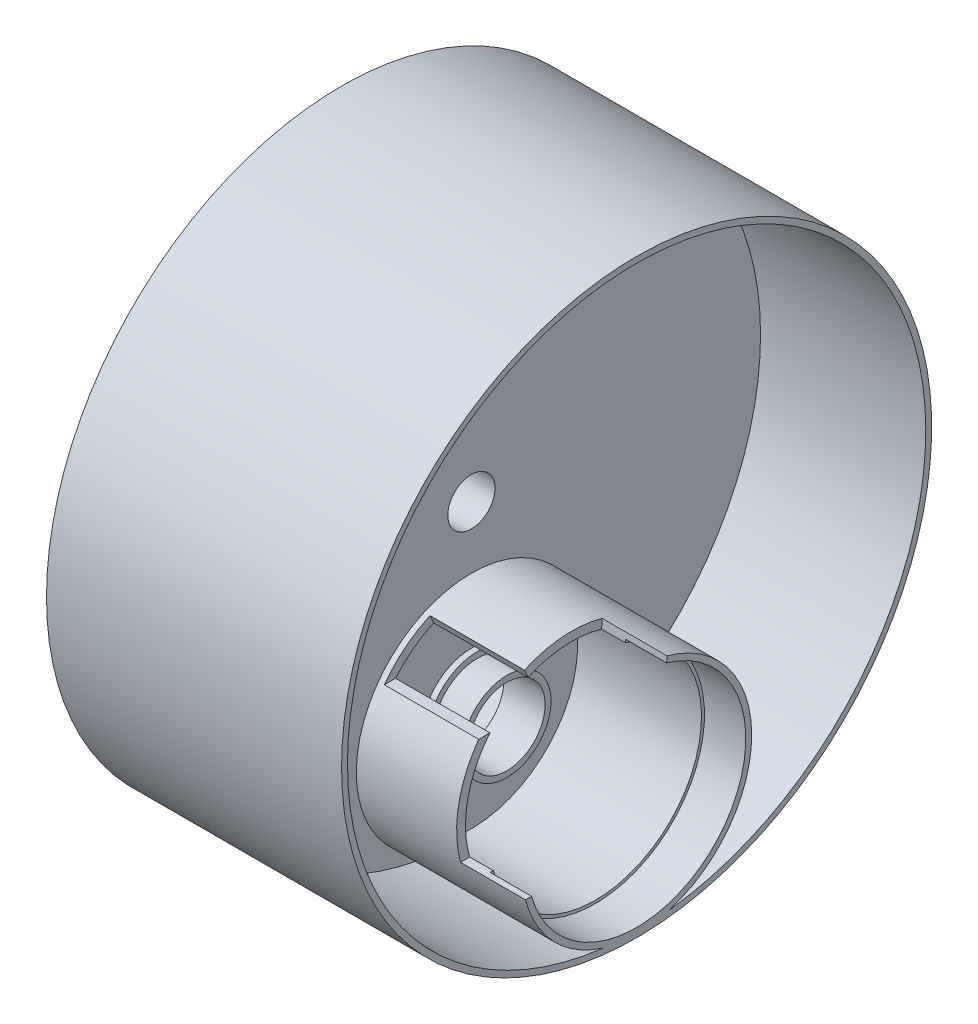
from build123d import *

# Parameters (mm, degrees)
CUT_EXTRUDE_START    = -11
CUT_EXTRUDE_1_DEPTH  = 11
CUT_EXTRUDE_2_DEPTH  = 27
EXTRUDE_START        = -1
SKETCH_4_R           = 50
SKETCH_4_R_2         = 4
SKETCH_4_R_3         = 6.5
EXTRUDE_1_DEPTH      = 1
EXTRUDE_2_DEPTH      = 21
EXTRUDE_2_DEPTH_BACK = 29
SKETCH_5_R           = 50
SKETCH_5_R_2         = 49
SKETCH_6_R           = 5
SKETCH_6_R_2         = 4
EXTRUDE_3_DEPTH      = 20


with BuildPart() as part:
    # Эскиз1 → Повернуть1 (revolve)
    with BuildSketch(Plane.XY):
        Polygon((-27, 7.5), (-27, 8.5), (-28, 8.5), (-28, 18), (-7, 18), (-7, 18.5), (0, 18.5), (0, 19.5), (-29, 19.5), (-29, 6.5), (-22, 6.5), (-22, 7.5), align=None)
    revolve(axis=Axis((0, 0, 0), (1, 0, 0)))

    # Эскиз2 → Вырез-Вытянуть1 (cut)
    with BuildSketch(Plane(origin=(0, 0, 0), x_dir=(0, 0, -1), z_dir=(1, 0, 0)).offset(CUT_EXTRUDE_START)):
        with BuildLine():
            Line((5.156251293, 18.805931846), (5, 16.248076809))
            ThreePointArc((5, 16.248076809), (-12.02081528, 12.02081528), (-16.248076809, -5))
            Line((-16.248076809, -5), (-18.848076825, -5))
            ThreePointArc((-18.848076825, -5), (-13.731246096, 13.845680938), (5.156251293, 18.805931846))
        make_face()
    extrude(amount=CUT_EXTRUDE_1_DEPTH, mode=Mode.SUBTRACT)

    # Эскиз3 → Вырез-Вытянуть2 (cut)
    with BuildSketch(Plane(origin=(0, 0, 0), x_dir=(0, 0, -1), z_dir=(1, 0, 0))):
        with BuildLine():
            Line((-40, 11.5), (-12.519984026, 11.5))
            ThreePointArc((-12.519984026, 11.5), (-9.954045186, 13.781037132), (-6.982120022, 15.5))
            Line((-6.982120022, 15.5), (-13.240816858, 29.394032278))
            Line((-13.240816858, 29.394032278), (-40, 11.5))
        make_face()
    extrude(amount=-CUT_EXTRUDE_2_DEPTH, mode=Mode.SUBTRACT)

    # Эскиз4 → Бобышка-Вытянуть1 (add)
    with BuildSketch(Plane.ZY.offset(29).offset(EXTRUDE_START)):
        with Locations((0, 30)):
            Circle(SKETCH_4_R)
        with Locations((0, 30)):
            Circle(SKETCH_4_R_2, mode=Mode.SUBTRACT)
        Circle(SKETCH_4_R_3, mode=Mode.SUBTRACT)
    extrude(amount=EXTRUDE_1_DEPTH)

    # Эскиз5 → Бобышка-Вытянуть2 (add, two sides: drawn at the far end of the back side and taken through both)
    with BuildSketch(Plane.ZY.offset(29).offset(-EXTRUDE_2_DEPTH_BACK)):
        with Locations((0, 30)):
            Circle(SKETCH_5_R)
        with Locations((0, 30)):
            Circle(SKETCH_5_R_2, mode=Mode.SUBTRACT)
    extrude(amount=EXTRUDE_2_DEPTH + EXTRUDE_2_DEPTH_BACK)

    # Эскиз6 → Бобышка-Вытянуть3 (add)
    with BuildSketch(Plane.ZY.offset(29)):
        with Locations((0, 30)):
            Circle(SKETCH_6_R)
        with Locations((0, 30)):
            Circle(SKETCH_6_R_2, mode=Mode.SUBTRACT)
    extrude(amount=EXTRUDE_3_DEPTH)


solid = part.part
